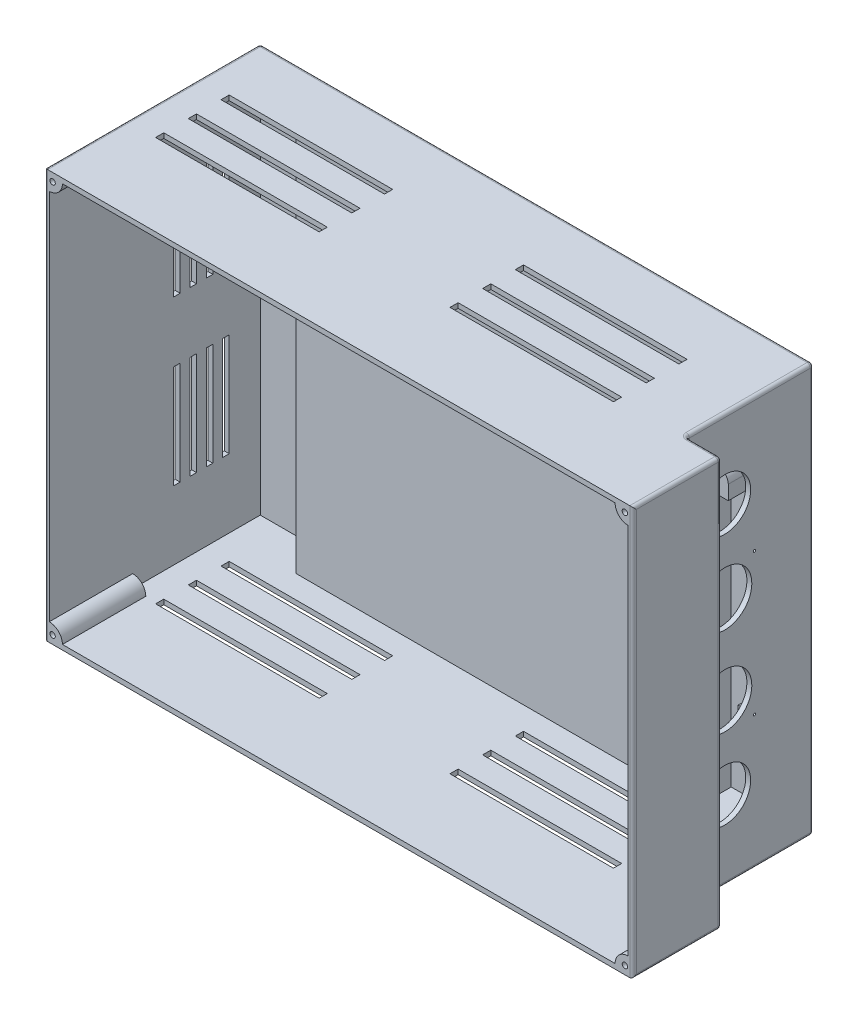
from build123d import *

# Parameters (mm, degrees)
SKETCH_2_W                      = 180
SKETCH_2_H                      = 125
EXTRUDE_1_DEPTH                 = 66
SKETCH_3_W                      = 120
SKETCH_3_H                      = 119
CUT_EXTRUDE_1_DEPTH             = 10
SKETCH_4_W                      = 39
SKETCH_4_H                      = 125
CUT_EXTRUDE_2_DEPTH             = 10.8
SHELL_START                     = -61
SHELL_1_DEPTH                   = 122
EXTRUDE_START                   = -3
SKETCH_6_W                      = 4
SKETCH_6_H                      = 4
EXTRUDE_2_DEPTH                 = 1.5
CUT_EXTRUDE_3_REACH             = 194.07
SKETCH_7_R                      = 8.25
SKETCH_7_R_2                    = 0.375
SKETCH_7_R_3                    = 7.9
CUT_EXTRUDE_4_REACH             = 169.574
SKETCH_8_W                      = 50
SKETCH_8_H                      = 2.5
CUT_EXTRUDE_4_DIRECTION_2_DEPTH = 168.573864311
EXTRUDE_START_2                 = -25.5
SKETCH_9_R                      = 0.825
EXTRUDE_3_DEPTH                 = 25.5
SKETCH_10_W                     = 7.200985522
SKETCH_10_H                     = 10.424307849
SKETCH_10_R                     = 0.825
SKETCH_10_W_2                   = 7.012984506
SKETCH_10_H_2                   = 7.372999746
EXTRUDE_4_DEPTH                 = 7.899949
CUT_EXTRUDE_5_REACH             = 129.915
SKETCH_11_R                     = 6.1
SKETCH_11_R_2                   = 2.6
FILLET_1_R                      = 3
FILLET_2_R                      = 1
CUT_EXTRUDE_6_REACH             = 203.649
SKETCH_12_W                     = 2
SKETCH_12_H                     = 31.5


# Read off the part's stored shape, not the designer's step: 抽壳1
with BuildPart() as part:
    # 草图2 → 凸台-拉伸1 (new body)
    with BuildSketch(Plane.XY):
        Rectangle(SKETCH_2_W, SKETCH_2_H)
    extrude(amount=EXTRUDE_1_DEPTH)

    # 草图3 → 切除-拉伸1 (cut)
    with BuildSketch(Plane(origin=(0, 0, 0), x_dir=(-1, 0, 0), z_dir=(0, 0, -1))):
        with Locations((6, 0)):
            Rectangle(SKETCH_3_W, SKETCH_3_H)
    extrude(amount=-CUT_EXTRUDE_1_DEPTH, mode=Mode.SUBTRACT)

    # 草图4 → 切除-拉伸2 (cut)
    with BuildSketch(Plane(origin=(90, 0, 0), x_dir=(0, 0, -1), z_dir=(1, 0, 0))):
        with Locations((-19.5, 0)):
            Rectangle(SKETCH_4_W, SKETCH_4_H)
    extrude(amount=-CUT_EXTRUDE_2_DEPTH, mode=Mode.SUBTRACT)

    # 抽壳1 outline → 抽壳1 (cut)
    with BuildSketch(Plane(origin=(0, 0, 0), x_dir=(1, 0, 0), z_dir=(0, 1, 0)).offset(SHELL_START)):
        Polygon((77.7, -1.5), (55.5, -1.5), (55.5, -11.5), (-67.5, -11.5), (-67.5, -1.5), (-88.5, -1.5), (-88.5, -66), (88.5, -66), (88.5, -40.5), (77.7, -40.5), align=None)
    extrude(amount=SHELL_1_DEPTH, mode=Mode.SUBTRACT)

    # 草图6 → 凸台-拉伸2 (add)
    with BuildSketch(Plane(origin=(79.2, 0, 0), x_dir=(0, 0, -1), z_dir=(1, 0, 0)).offset(EXTRUDE_START)):
        with Locations((-18.064716044, -21.665100098)):
            Rectangle(SKETCH_6_W, SKETCH_6_H)
        with Locations((-36.221233073, -21.665100098)):
            Rectangle(SKETCH_6_W, SKETCH_6_H)
        with Locations((-36.221233073, 21.665100098)):
            Rectangle(SKETCH_6_W, SKETCH_6_H)
        with Locations((-18.064716044, 21.665100098)):
            Rectangle(SKETCH_6_W, SKETCH_6_H)
    extrude(amount=EXTRUDE_2_DEPTH)

    # 草图7 → 切除-拉伸3 (cut, up to next)
    with BuildSketch(Plane(origin=(79.2, 0, 0), x_dir=(0, 0, -1), z_dir=(1, 0, 0)), mode=Mode.PRIVATE) as cut_extrude_3_sk1:
        with Locations(Location((-27.142974559, -13.5, 0), (0, 0, 90))):
            Circle(SKETCH_7_R)
    cut_extrude_3_tool1 = extrude(cut_extrude_3_sk1.sketch, amount=-CUT_EXTRUDE_3_REACH, mode=Mode.PRIVATE) & part.part
    # 草图7 → 切除-拉伸3 (cut, up to next)
    with BuildSketch(Plane(origin=(79.2, 0, 0), x_dir=(0, 0, -1), z_dir=(1, 0, 0)), mode=Mode.PRIVATE) as cut_extrude_3_sk2:
        with Locations(Location((-27.142974559, 13.5, 0), (0, 0, 90))):
            Circle(SKETCH_7_R)
    cut_extrude_3_tool2 = extrude(cut_extrude_3_sk2.sketch, amount=-CUT_EXTRUDE_3_REACH, mode=Mode.PRIVATE) & part.part
    # 草图7 → 切除-拉伸3 (cut, up to next)
    with BuildSketch(Plane(origin=(79.2, 0, 0), x_dir=(0, 0, -1), z_dir=(1, 0, 0)), mode=Mode.PRIVATE) as cut_extrude_3_sk3:
        with Locations(Location((-18.064716044, -21.665100098, 0), (0, 0, 90))):
            Circle(SKETCH_7_R_2)
    cut_extrude_3_tool3 = extrude(cut_extrude_3_sk3.sketch, amount=-CUT_EXTRUDE_3_REACH, mode=Mode.PRIVATE) & part.part
    # 草图7 → 切除-拉伸3 (cut, up to next)
    with BuildSketch(Plane(origin=(79.2, 0, 0), x_dir=(0, 0, -1), z_dir=(1, 0, 0)), mode=Mode.PRIVATE) as cut_extrude_3_sk4:
        with Locations(Location((-18.064716044, 21.665100098, 0), (0, 0, 90))):
            Circle(SKETCH_7_R_2)
    cut_extrude_3_tool4 = extrude(cut_extrude_3_sk4.sketch, amount=-CUT_EXTRUDE_3_REACH, mode=Mode.PRIVATE) & part.part
    # 草图7 → 切除-拉伸3 (cut, up to next)
    with BuildSketch(Plane(origin=(79.2, 0, 0), x_dir=(0, 0, -1), z_dir=(1, 0, 0)), mode=Mode.PRIVATE) as cut_extrude_3_sk5:
        with Locations(Location((-36.221233073, 21.665100098, 0), (0, 0, 90))):
            Circle(SKETCH_7_R_2)
    cut_extrude_3_tool5 = extrude(cut_extrude_3_sk5.sketch, amount=-CUT_EXTRUDE_3_REACH, mode=Mode.PRIVATE) & part.part
    # 草图7 → 切除-拉伸3 (cut, up to next)
    with BuildSketch(Plane(origin=(79.2, 0, 0), x_dir=(0, 0, -1), z_dir=(1, 0, 0)), mode=Mode.PRIVATE) as cut_extrude_3_sk6:
        with Locations(Location((-36.221233073, -21.665100098, 0), (0, 0, 90))):
            Circle(SKETCH_7_R_2)
    cut_extrude_3_tool6 = extrude(cut_extrude_3_sk6.sketch, amount=-CUT_EXTRUDE_3_REACH, mode=Mode.PRIVATE) & part.part
    # 草图7 → 切除-拉伸3 (cut, up to next)
    with BuildSketch(Plane(origin=(79.2, 0, 0), x_dir=(0, 0, -1), z_dir=(1, 0, 0)), mode=Mode.PRIVATE) as cut_extrude_3_sk7:
        with Locations(Location((-27.142974559, 38.5, 0), (0, 0, 90))):
            Circle(SKETCH_7_R_3)
    cut_extrude_3_tool7 = extrude(cut_extrude_3_sk7.sketch, amount=-CUT_EXTRUDE_3_REACH, mode=Mode.PRIVATE) & part.part
    # 草图7 → 切除-拉伸3 (cut, up to next)
    with BuildSketch(Plane(origin=(79.2, 0, 0), x_dir=(0, 0, -1), z_dir=(1, 0, 0)), mode=Mode.PRIVATE) as cut_extrude_3_sk8:
        with Locations(Location((-27.142974559, -38.5, 0), (0, 0, 90))):
            Circle(SKETCH_7_R_3)
    cut_extrude_3_tool8 = extrude(cut_extrude_3_sk8.sketch, amount=-CUT_EXTRUDE_3_REACH, mode=Mode.PRIVATE) & part.part
    add(cut_extrude_3_tool1.solids().sort_by_distance((79.2, -13.5, 27.142975))[0], mode=Mode.SUBTRACT)
    add(cut_extrude_3_tool2.solids().sort_by_distance((79.2, 13.5, 27.142975))[0], mode=Mode.SUBTRACT)
    add(cut_extrude_3_tool3.solids().sort_by_distance((79.2, -21.6651, 18.064716))[0], mode=Mode.SUBTRACT)
    add(cut_extrude_3_tool4.solids().sort_by_distance((79.2, 21.6651, 18.064716))[0], mode=Mode.SUBTRACT)
    add(cut_extrude_3_tool5.solids().sort_by_distance((79.2, 21.6651, 36.221233))[0], mode=Mode.SUBTRACT)
    add(cut_extrude_3_tool6.solids().sort_by_distance((79.2, -21.6651, 36.221233))[0], mode=Mode.SUBTRACT)
    add(cut_extrude_3_tool7.solids().sort_by_distance((79.2, 38.5, 27.142975))[0], mode=Mode.SUBTRACT)
    add(cut_extrude_3_tool8.solids().sort_by_distance((79.2, -38.5, 27.142975))[0], mode=Mode.SUBTRACT)

    # 切除-拉伸4: up to this face of the body (flat: up to its plane)
    cut_extrude_4_end = Plane(part.part.faces().sort_by_distance((-3.109707823, 62.5, 33.496229972))[0])
    # 草图8 → 切除-拉伸4 (cut, up to the picked face)
    with BuildSketch(Plane.XZ.offset(62.5), mode=Mode.PRIVATE) as cut_extrude_4_sk1:
        with Locations((-56, 39.75)):
            Rectangle(SKETCH_8_W, SKETCH_8_H)
    cut_extrude_4_tool1 = split(extrude(cut_extrude_4_sk1.sketch, amount=-CUT_EXTRUDE_4_REACH, mode=Mode.PRIVATE), bisect_by=cut_extrude_4_end, keep=Keep.BOTH, mode=Mode.PRIVATE)
    # 草图8 → 切除-拉伸4 (cut, up to the picked face)
    with BuildSketch(Plane.XZ.offset(62.5), mode=Mode.PRIVATE) as cut_extrude_4_sk2:
        with Locations((34, 39.75)):
            Rectangle(SKETCH_8_W, SKETCH_8_H)
    cut_extrude_4_tool2 = split(extrude(cut_extrude_4_sk2.sketch, amount=-CUT_EXTRUDE_4_REACH, mode=Mode.PRIVATE), bisect_by=cut_extrude_4_end, keep=Keep.BOTH, mode=Mode.PRIVATE)
    # 草图8 → 切除-拉伸4 (cut, up to the picked face)
    with BuildSketch(Plane.XZ.offset(62.5), mode=Mode.PRIVATE) as cut_extrude_4_sk3:
        with Locations((34, 29.75)):
            Rectangle(SKETCH_8_W, SKETCH_8_H)
    cut_extrude_4_tool3 = split(extrude(cut_extrude_4_sk3.sketch, amount=-CUT_EXTRUDE_4_REACH, mode=Mode.PRIVATE), bisect_by=cut_extrude_4_end, keep=Keep.BOTH, mode=Mode.PRIVATE)
    # 草图8 → 切除-拉伸4 (cut, up to the picked face)
    with BuildSketch(Plane.XZ.offset(62.5), mode=Mode.PRIVATE) as cut_extrude_4_sk4:
        with Locations((34, 19.75)):
            Rectangle(SKETCH_8_W, SKETCH_8_H)
    cut_extrude_4_tool4 = split(extrude(cut_extrude_4_sk4.sketch, amount=-CUT_EXTRUDE_4_REACH, mode=Mode.PRIVATE), bisect_by=cut_extrude_4_end, keep=Keep.BOTH, mode=Mode.PRIVATE)
    # 草图8 → 切除-拉伸4 (cut, up to the picked face)
    with BuildSketch(Plane.XZ.offset(62.5), mode=Mode.PRIVATE) as cut_extrude_4_sk5:
        with Locations((-56, 29.75)):
            Rectangle(SKETCH_8_W, SKETCH_8_H)
    cut_extrude_4_tool5 = split(extrude(cut_extrude_4_sk5.sketch, amount=-CUT_EXTRUDE_4_REACH, mode=Mode.PRIVATE), bisect_by=cut_extrude_4_end, keep=Keep.BOTH, mode=Mode.PRIVATE)
    # 草图8 → 切除-拉伸4 (cut, up to the picked face)
    with BuildSketch(Plane.XZ.offset(62.5), mode=Mode.PRIVATE) as cut_extrude_4_sk6:
        with Locations((-56, 19.75)):
            Rectangle(SKETCH_8_W, SKETCH_8_H)
    cut_extrude_4_tool6 = split(extrude(cut_extrude_4_sk6.sketch, amount=-CUT_EXTRUDE_4_REACH, mode=Mode.PRIVATE), bisect_by=cut_extrude_4_end, keep=Keep.BOTH, mode=Mode.PRIVATE)
    add(cut_extrude_4_tool1.solids().sort_by(Axis((-56, -62.5, 39.75), (0, 1, 0)))[0], mode=Mode.SUBTRACT)
    add(cut_extrude_4_tool2.solids().sort_by(Axis((34, -62.5, 39.75), (0, 1, 0)))[0], mode=Mode.SUBTRACT)
    add(cut_extrude_4_tool3.solids().sort_by(Axis((34, -62.5, 29.75), (0, 1, 0)))[0], mode=Mode.SUBTRACT)
    add(cut_extrude_4_tool4.solids().sort_by(Axis((34, -62.5, 19.75), (0, 1, 0)))[0], mode=Mode.SUBTRACT)
    add(cut_extrude_4_tool5.solids().sort_by(Axis((-56, -62.5, 29.75), (0, 1, 0)))[0], mode=Mode.SUBTRACT)
    add(cut_extrude_4_tool6.solids().sort_by(Axis((-56, -62.5, 19.75), (0, 1, 0)))[0], mode=Mode.SUBTRACT)

    # 草图8 → 切除-拉伸4 direction 2 (cut)
    with BuildSketch(Plane.XZ.offset(62.5)):
        with Locations((-56, 39.75)):
            Rectangle(SKETCH_8_W, SKETCH_8_H)
        with Locations((34, 39.75)):
            Rectangle(SKETCH_8_W, SKETCH_8_H)
        with Locations((34, 29.75)):
            Rectangle(SKETCH_8_W, SKETCH_8_H)
        with Locations((34, 19.75)):
            Rectangle(SKETCH_8_W, SKETCH_8_H)
        with Locations((-56, 29.75)):
            Rectangle(SKETCH_8_W, SKETCH_8_H)
        with Locations((-56, 19.75)):
            Rectangle(SKETCH_8_W, SKETCH_8_H)
    extrude(amount=CUT_EXTRUDE_4_DIRECTION_2_DEPTH, mode=Mode.SUBTRACT)

    # 草图9 → 凸台-拉伸3 (add)
    # profile 1 of 4: a face of its own
    with BuildSketch(Plane.XY.offset(66).offset(EXTRUDE_START_2)):
        with BuildLine():
            Line((-88.5, 61), (-84.5, 61))
            ThreePointArc((-84.5, 61), (-85.671572875, 58.171572875), (-88.5, 57))
            Line((-88.5, 57), (-88.5, 61))
        make_face()
        with Locations((-87.5, 60)):
            Circle(SKETCH_9_R, mode=Mode.SUBTRACT)
    # profile 2 of 4: a face of its own
    with BuildSketch(Plane.XY.offset(66).offset(EXTRUDE_START_2)):
        with BuildLine():
            Line((-88.5, -61), (-88.5, -57))
            ThreePointArc((-88.5, -57), (-85.671572875, -58.171572875), (-84.5, -61))
            Line((-84.5, -61), (-88.5, -61))
        make_face()
        with Locations((-87.5, -60)):
            Circle(SKETCH_9_R, mode=Mode.SUBTRACT)
    # profile 3 of 4: a face of its own
    with BuildSketch(Plane.XY.offset(66).offset(EXTRUDE_START_2)):
        with BuildLine():
            Line((88.5, -61), (84.5, -61))
            ThreePointArc((84.5, -61), (85.671572875, -58.171572875), (88.5, -57))
            Line((88.5, -57), (88.5, -61))
        make_face()
        with Locations((87.5, -60)):
            Circle(SKETCH_9_R, mode=Mode.SUBTRACT)
    # profile 4 of 4: a face of its own
    with BuildSketch(Plane.XY.offset(66).offset(EXTRUDE_START_2)):
        with BuildLine():
            Line((88.5, 61), (88.5, 57))
            ThreePointArc((88.5, 57), (85.671572875, 58.171572875), (84.5, 61))
            Line((84.5, 61), (88.5, 61))
        make_face()
        with Locations((87.5, 60)):
            Circle(SKETCH_9_R, mode=Mode.SUBTRACT)
    extrude(amount=EXTRUDE_3_DEPTH)

    # 草图10 → 开关螺孔凸台-拉伸4 (add)
    # profile 1 of 4: a face of its own
    with BuildSketch(Plane.XY.offset(1.5)):
        with Locations((74.099507239, 55.787846076)):
            Rectangle(SKETCH_10_W, SKETCH_10_H)
        with Locations((74.126014732, 54.575692151)):
            Circle(SKETCH_10_R, mode=Mode.SUBTRACT)
    # profile 2 of 4: a face of its own
    with BuildSketch(Plane.XY.offset(1.5)):
        with Locations((59.006492253, 55.787846076)):
            Rectangle(SKETCH_10_W_2, SKETCH_10_H)
        with Locations((59.13998476, 54.575692151)):
            Circle(SKETCH_10_R, mode=Mode.SUBTRACT)
    # profile 3 of 4: a face of its own
    with BuildSketch(Plane.XY.offset(1.5)):
        with Locations((59.006492253, 25.941135382)):
            Rectangle(SKETCH_10_W_2, SKETCH_10_H_2)
        with Locations((59.012984506, 26.127635255)):
            Circle(SKETCH_10_R, mode=Mode.SUBTRACT)
    # profile 4 of 4: a face of its own
    with BuildSketch(Plane.XY.offset(1.5)):
        with Locations((74.099507239, 25.941135382)):
            Rectangle(SKETCH_10_W, SKETCH_10_H_2)
        with Locations((73.999014478, 26.254635509)):
            Circle(SKETCH_10_R, mode=Mode.SUBTRACT)
    extrude(amount=EXTRUDE_4_DEPTH)

    # 草图11 → 切除-拉伸5 (cut, up to next)
    with BuildSketch(Plane(origin=(0, 0, 0), x_dir=(-1, 0, 0), z_dir=(0, 0, -1)), mode=Mode.PRIVATE) as cut_extrude_5_sk1:
        with Locations((-66.76, 36.160655321)):
            Circle(SKETCH_11_R)
    cut_extrude_5_tool1 = extrude(cut_extrude_5_sk1.sketch, amount=-CUT_EXTRUDE_5_REACH, mode=Mode.PRIVATE) & part.part
    # 草图11 → 切除-拉伸5 (cut, up to next)
    with BuildSketch(Plane(origin=(0, 0, 0), x_dir=(-1, 0, 0), z_dir=(0, 0, -1)), mode=Mode.PRIVATE) as cut_extrude_5_sk2:
        with Locations((-65.481981904, 49.241681483)):
            Circle(SKETCH_11_R_2)
    cut_extrude_5_tool2 = extrude(cut_extrude_5_sk2.sketch, amount=-CUT_EXTRUDE_5_REACH, mode=Mode.PRIVATE) & part.part
    add(cut_extrude_5_tool1.solids().sort_by_distance((66.76, 36.160655, 0))[0], mode=Mode.SUBTRACT)
    add(cut_extrude_5_tool2.solids().sort_by_distance((65.481982, 49.241681, 0))[0], mode=Mode.SUBTRACT)

    # 圆角1
    fillet_1_edges = [part.edges().sort_by_distance(p)[0] for p in [
        (70.499014478, 50.575692151, 5.4499745),
        (62.512984506, 50.575692151, 5.4499745),
        (62.512984506, 29.627635255, 5.4499745),
        (70.499014478, 29.627635255, 5.4499745),
    ]]
    fillet(fillet_1_edges, radius=FILLET_1_R)

    # 圆角2
    fillet_2_edges = [part.edges().sort_by_distance(p)[0] for p in [
        (-90, 0, 66),
        (54, 0, 10),
        (-6, 59.5, 10),
        (-66, 0, 10),
        (-6, -59.5, 10),
        (54, 0, 0),
        (-6, -59.5, 0),
        (-66, 0, 0),
        (-6, 59.5, 0),
        (-5.4, 62.5, 0),
        (84.6, -62.5, 39),
        (84.6, 62.5, 39),
        (90, 0, 39),
        (79.2, 0, 0),
        (79.2, -62.5, 19.5),
        (79.2, 0, 39),
        (79.2, 62.5, 19.5),
        (72.86, 36.160655321, 0),
        (68.081981904, 49.241681483, 0),
        (90, 0, 66),
        (-5.4, -62.5, 0),
        (-90, 0, 0),
        (90, -62.5, 52.5),
        (-90, -62.5, 33),
        (-90, 62.5, 33),
        (90, 62.5, 52.5),
    ]]
    fillet(fillet_2_edges, radius=FILLET_2_R)

    # 草图12 → 切除-拉伸6 (cut, up to next)
    with BuildSketch(Plane.ZY.offset(90), mode=Mode.PRIVATE) as cut_extrude_6_sk1:
        with Locations((12, 25.75)):
            Rectangle(SKETCH_12_W, SKETCH_12_H)
    cut_extrude_6_tool1 = extrude(cut_extrude_6_sk1.sketch, amount=-CUT_EXTRUDE_6_REACH, mode=Mode.PRIVATE) & part.part
    # 草图12 → 切除-拉伸6 (cut, up to next)
    with BuildSketch(Plane.ZY.offset(90), mode=Mode.PRIVATE) as cut_extrude_6_sk2:
        with Locations((17, 25.75)):
            Rectangle(SKETCH_12_W, SKETCH_12_H)
    cut_extrude_6_tool2 = extrude(cut_extrude_6_sk2.sketch, amount=-CUT_EXTRUDE_6_REACH, mode=Mode.PRIVATE) & part.part
    # 草图12 → 切除-拉伸6 (cut, up to next)
    with BuildSketch(Plane.ZY.offset(90), mode=Mode.PRIVATE) as cut_extrude_6_sk3:
        with Locations((22, 25.75)):
            Rectangle(SKETCH_12_W, SKETCH_12_H)
    cut_extrude_6_tool3 = extrude(cut_extrude_6_sk3.sketch, amount=-CUT_EXTRUDE_6_REACH, mode=Mode.PRIVATE) & part.part
    # 草图12 → 切除-拉伸6 (cut, up to next)
    with BuildSketch(Plane.ZY.offset(90), mode=Mode.PRIVATE) as cut_extrude_6_sk4:
        with Locations((27, 25.75)):
            Rectangle(SKETCH_12_W, SKETCH_12_H)
    cut_extrude_6_tool4 = extrude(cut_extrude_6_sk4.sketch, amount=-CUT_EXTRUDE_6_REACH, mode=Mode.PRIVATE) & part.part
    # 草图12 → 切除-拉伸6 (cut, up to next)
    with BuildSketch(Plane.ZY.offset(90), mode=Mode.PRIVATE) as cut_extrude_6_sk5:
        with Locations((17, -24.25)):
            Rectangle(SKETCH_12_W, SKETCH_12_H)
    cut_extrude_6_tool5 = extrude(cut_extrude_6_sk5.sketch, amount=-CUT_EXTRUDE_6_REACH, mode=Mode.PRIVATE) & part.part
    # 草图12 → 切除-拉伸6 (cut, up to next)
    with BuildSketch(Plane.ZY.offset(90), mode=Mode.PRIVATE) as cut_extrude_6_sk6:
        with Locations((22, -24.25)):
            Rectangle(SKETCH_12_W, SKETCH_12_H)
    cut_extrude_6_tool6 = extrude(cut_extrude_6_sk6.sketch, amount=-CUT_EXTRUDE_6_REACH, mode=Mode.PRIVATE) & part.part
    # 草图12 → 切除-拉伸6 (cut, up to next)
    with BuildSketch(Plane.ZY.offset(90), mode=Mode.PRIVATE) as cut_extrude_6_sk7:
        with Locations((27, -24.25)):
            Rectangle(SKETCH_12_W, SKETCH_12_H)
    cut_extrude_6_tool7 = extrude(cut_extrude_6_sk7.sketch, amount=-CUT_EXTRUDE_6_REACH, mode=Mode.PRIVATE) & part.part
    # 草图12 → 切除-拉伸6 (cut, up to next)
    with BuildSketch(Plane.ZY.offset(90), mode=Mode.PRIVATE) as cut_extrude_6_sk8:
        with Locations((12, -24.25)):
            Rectangle(SKETCH_12_W, SKETCH_12_H)
    cut_extrude_6_tool8 = extrude(cut_extrude_6_sk8.sketch, amount=-CUT_EXTRUDE_6_REACH, mode=Mode.PRIVATE) & part.part
    add(cut_extrude_6_tool1.solids().sort_by_distance((-90, 25.75, 12))[0], mode=Mode.SUBTRACT)
    add(cut_extrude_6_tool2.solids().sort_by_distance((-90, 25.75, 17))[0], mode=Mode.SUBTRACT)
    add(cut_extrude_6_tool3.solids().sort_by_distance((-90, 25.75, 22))[0], mode=Mode.SUBTRACT)
    add(cut_extrude_6_tool4.solids().sort_by_distance((-90, 25.75, 27))[0], mode=Mode.SUBTRACT)
    add(cut_extrude_6_tool5.solids().sort_by_distance((-90, -24.25, 17))[0], mode=Mode.SUBTRACT)
    add(cut_extrude_6_tool6.solids().sort_by_distance((-90, -24.25, 22))[0], mode=Mode.SUBTRACT)
    add(cut_extrude_6_tool7.solids().sort_by_distance((-90, -24.25, 27))[0], mode=Mode.SUBTRACT)
    add(cut_extrude_6_tool8.solids().sort_by_distance((-90, -24.25, 12))[0], mode=Mode.SUBTRACT)


solid = part.part
